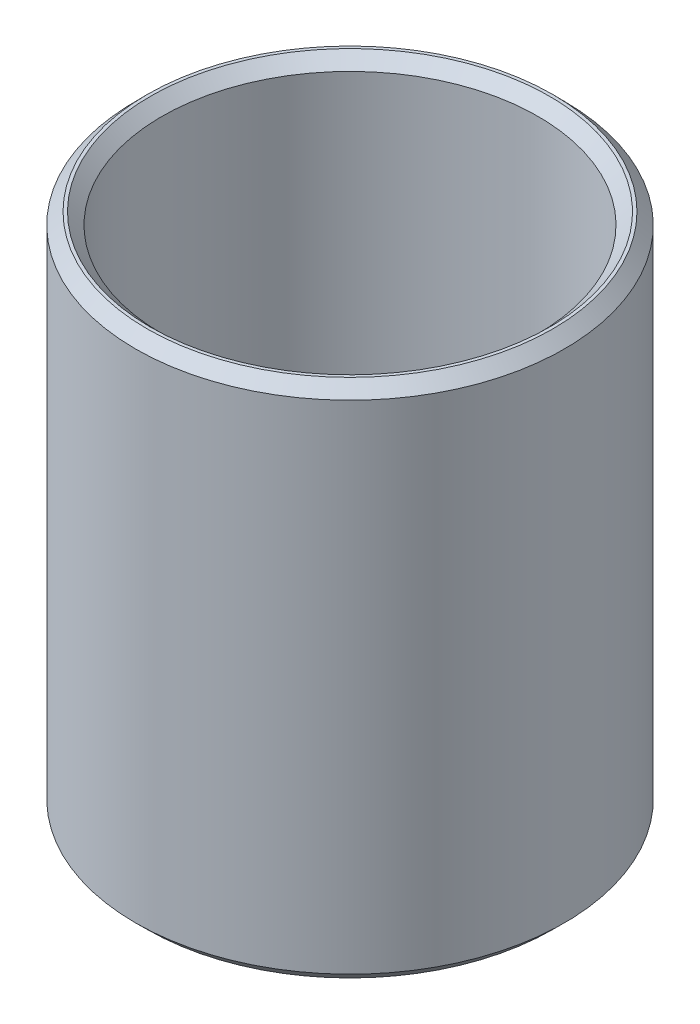
from build123d import *
from OCP.BRepFilletAPI import BRepFilletAPI_MakeChamfer

# Parameters (mm, degrees)
SKETCH1_R           = 32.5
BOSS_EXTRUDE1_DEPTH = 78.846737651
SKETCH2_R           = 28.51065851
CUT_EXTRUDE1_DEPTH  = 92.265042805
CHAMFER1_SIZE       = 1.768038797
CHAMFER1_SIZE2      = 1.744910461


with BuildPart() as part:
    # Sketch1 → Boss-Extrude1 (new body)
    with BuildSketch(Plane(origin=(0, 0, 0), x_dir=(1, 0, 0), z_dir=(0, 1, 0))):
        Circle(SKETCH1_R)
    extrude(amount=BOSS_EXTRUDE1_DEPTH)

    # Sketch2 → Cut-Extrude1 (cut, through all)
    with BuildSketch(Plane(origin=(0, 0, 0), x_dir=(1, 0, 0), z_dir=(0, 1, 0))):
        Circle(SKETCH2_R)
    extrude(amount=CUT_EXTRUDE1_DEPTH, mode=Mode.SUBTRACT)

    # Chamfer1: one chamfer whose edges measure the first distance from different faces: ONE call of the kernel's chamfer builder (chamfer() names one face for all edges)
    chamfer1_edges_1 = [part.edges().sort_by_distance(p)[0] for p in [
        (-28.51065851, 78.846737651, 0),
    ]]
    chamfer1_side_1 = [part.faces().sort_by_distance(p)[0] for p in [
        (-31.580761184, 78.846737651, 0),
    ]]
    chamfer1_edges_2 = [part.edges().sort_by_distance(p)[0] for p in [
        (-28.51065851, 0, 0),
    ]]
    chamfer1_side_2 = [part.faces().sort_by_distance(p)[0] for p in [
        (-28.51065851, 39.423368826, 0),
    ]]
    chamfer1_edges_3 = [part.edges().sort_by_distance(p)[0] for p in [
        (-32.5, 0, 0),
    ]]
    chamfer1_side_3 = [part.faces().sort_by_distance(p)[0] for p in [
        (-31.580761184, 0, 0),
    ]]
    chamfer1_edges_4 = [part.edges().sort_by_distance(p)[0] for p in [
        (-32.5, 78.846737651, 0),
    ]]
    chamfer1_side_4 = [part.faces().sort_by_distance(p)[0] for p in [
        (-32.5, 39.423368826, 0),
    ]]
    chamfer1 = BRepFilletAPI_MakeChamfer(part.part.solid().wrapped)
    for e in chamfer1_edges_1:
        chamfer1.Add(CHAMFER1_SIZE, CHAMFER1_SIZE2, e.wrapped, chamfer1_side_1[0].wrapped)  # the first distance lies on this face
    for e in chamfer1_edges_2:
        chamfer1.Add(CHAMFER1_SIZE, CHAMFER1_SIZE2, e.wrapped, chamfer1_side_2[0].wrapped)  # the first distance lies on this face
    for e in chamfer1_edges_3:
        chamfer1.Add(CHAMFER1_SIZE, CHAMFER1_SIZE2, e.wrapped, chamfer1_side_3[0].wrapped)  # the first distance lies on this face
    for e in chamfer1_edges_4:
        chamfer1.Add(CHAMFER1_SIZE, CHAMFER1_SIZE2, e.wrapped, chamfer1_side_4[0].wrapped)  # the first distance lies on this face
    add(Compound.cast(chamfer1.Shape()), mode=Mode.REPLACE)


solid = part.part
